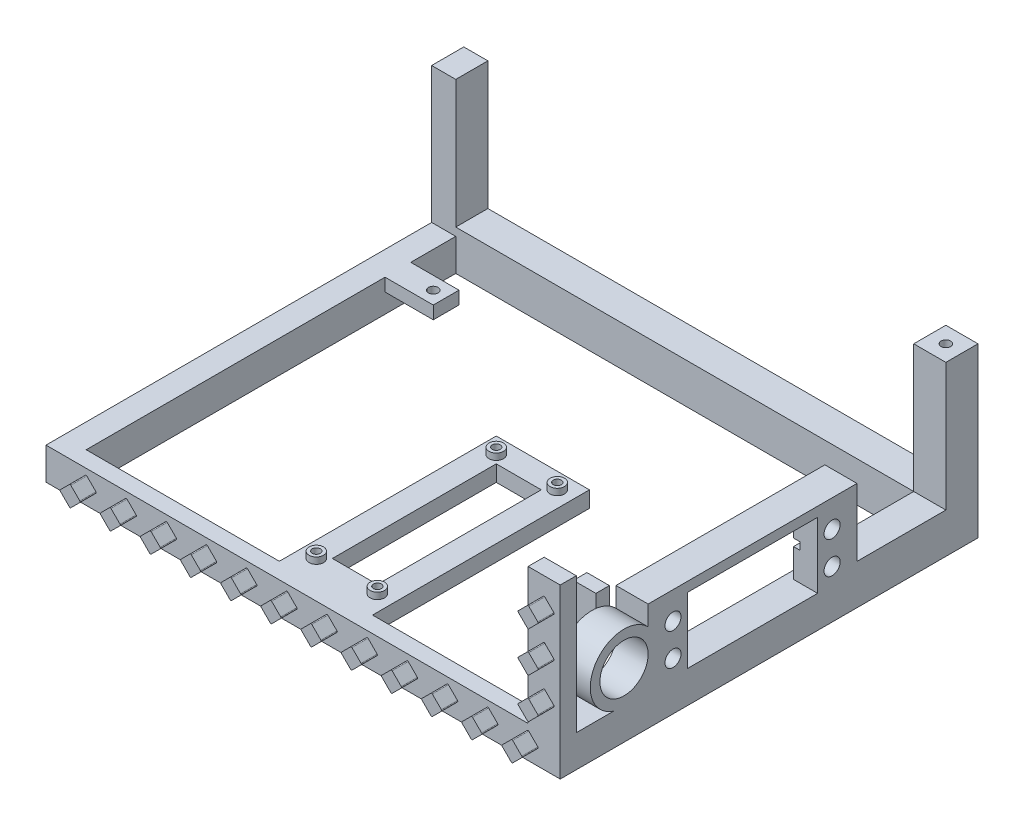
from build123d import *

# Parameters (mm, degrees)
SKETCH1_W            = 160
SKETCH1_H            = 130
BOSS_EXTRUDE1_DEPTH  = 10
BOSS_EXTRUDE2_DEPTH  = 42.3
BOSS_EXTRUDE3_DEPTH  = 5
SKETCH7_R            = 1.5
CUT_EXTRUDE2_DEPTH   = 118.958848757
CUT_EXTRUDE3_DEPTH   = 118.958848757
SKETCH11_R           = 1.5
CUT_EXTRUDE6_DEPTH   = 4
SKETCH12_W           = 142.5
SKETCH12_H           = 39.8
CUT_EXTRUDE7_DEPTH   = 160.954024645
SKETCH15_W           = 29
SKETCH15_H           = 67.5
SKETCH15_W_2         = 14
SKETCH15_H_2         = 51
SKETCH15_R           = 1.25
BOSS_EXTRUDE4_DEPTH  = 5
BOSS_EXTRUDE5_START  = 2
SKETCH15_4_R         = 2.25
SKETCH15_4_R_2       = 1.25
BOSS_EXTRUDE5_DEPTH  = 2
CUT_EXTRUDE20_DEPTH  = 5.25
SKETCH26_W           = 15
SKETCH26_H           = 8
CUT_EXTRUDE21_DEPTH  = 6
SKETCH36_W           = 55
SKETCH36_H           = 20.5
CUT_EXTRUDE27_DEPTH  = 2.5
SKETCH37_W           = 7.25
SKETCH37_H           = 2.3
CUT_EXTRUDE28_DEPTH  = 2
CUT_EXTRUDE30_DEPTH  = 10
SKETCH40_R           = 7.5
CUT_EXTRUDE32_DEPTH  = 10
SKETCH38_R           = 2.5
CUT_EXTRUDE33_DEPTH  = 10
SKETCH41_W           = 40.5
SKETCH41_H           = 20.5
CUT_EXTRUDE34_DEPTH  = 10
SKETCH48_W           = 4.2
SKETCH48_H           = 3
BOSS_EXTRUDE9_DEPTH  = 21.5
SKETCH49_W           = 7
SKETCH49_H           = 4.2
BOSS_EXTRUDE10_DEPTH = 10


with BuildPart() as part:
    # Sketch1 → Boss-Extrude1 (new body)
    with BuildSketch(Plane(origin=(0, 0, 0), x_dir=(1, 0, 0), z_dir=(0, 1, 0))):
        with Locations((-5, 5)):
            Rectangle(SKETCH1_W, SKETCH1_H)
    extrude(amount=BOSS_EXTRUDE1_DEPTH)

    # Sketch2 → Boss-Extrude2 (add)
    with BuildSketch(Plane(origin=(0, 10, 0), x_dir=(1, 0, 0), z_dir=(0, 1, 0))):
        Polygon((-85, 70), (75, 70), (75, -60), (65, -60), (65, 60), (-85, 60), align=None)
    extrude(amount=BOSS_EXTRUDE2_DEPTH)

    # Sketch6 → Boss-Extrude3 (add)
    with BuildSketch(Plane.XY.offset(60)):
        with BuildLine():
            Line((69.787867966, 40.612132034), (66.962132034, 43.437867966))
            ThreePointArc((66.962132034, 43.437867966), (66.874264069, 43.65), (66.962132034, 43.862132034))
            Line((66.962132034, 43.862132034), (69.787867966, 46.687867966))
            ThreePointArc((69.787867966, 46.687867966), (70, 46.775735931), (70.212132034, 46.687867966))
            Line((70.212132034, 46.687867966), (73.037867966, 43.862132034))
            ThreePointArc((73.037867966, 43.862132034), (73.125735931, 43.65), (73.037867966, 43.437867966))
            Line((73.037867966, 43.437867966), (70.212132034, 40.612132034))
            ThreePointArc((70.212132034, 40.612132034), (70, 40.524264069), (69.787867966, 40.612132034))
        make_face()
        with BuildLine():
            Line((-10.212132034, 8.037867966), (-13.037867966, 5.212132034))
            ThreePointArc((-13.037867966, 5.212132034), (-13.125735931, 5), (-13.037867966, 4.787867966))
            Line((-13.037867966, 4.787867966), (-10.212132034, 1.962132034))
            ThreePointArc((-10.212132034, 1.962132034), (-10, 1.874264069), (-9.787867966, 1.962132034))
            Line((-9.787867966, 1.962132034), (-6.962132034, 4.787867966))
            ThreePointArc((-6.962132034, 4.787867966), (-6.874264069, 5), (-6.962132034, 5.212132034))
            Line((-6.962132034, 5.212132034), (-9.787867966, 8.037867966))
            ThreePointArc((-9.787867966, 8.037867966), (-10, 8.125735931), (-10.212132034, 8.037867966))
        make_face()
        with BuildLine():
            Line((66.962132034, 31.362132034), (69.787867966, 34.187867966))
            ThreePointArc((69.787867966, 34.187867966), (70, 34.275735931), (70.212132034, 34.187867966))
            Line((70.212132034, 34.187867966), (73.037867966, 31.362132034))
            ThreePointArc((73.037867966, 31.362132034), (73.125735931, 31.15), (73.037867966, 30.937867966))
            Line((73.037867966, 30.937867966), (70.212132034, 28.112132034))
            ThreePointArc((70.212132034, 28.112132034), (70, 28.024264069), (69.787867966, 28.112132034))
            Line((69.787867966, 28.112132034), (66.962132034, 30.937867966))
            ThreePointArc((66.962132034, 30.937867966), (66.874264069, 31.15), (66.962132034, 31.362132034))
        make_face()
        with BuildLine():
            Line((5.537867966, 5.212132034), (2.712132034, 8.037867966))
            ThreePointArc((2.712132034, 8.037867966), (2.5, 8.125735931), (2.287867966, 8.037867966))
            Line((2.287867966, 8.037867966), (-0.537867966, 5.212132034))
            ThreePointArc((-0.537867966, 5.212132034), (-0.625735931, 5), (-0.537867966, 4.787867966))
            Line((-0.537867966, 4.787867966), (2.287867966, 1.962132034))
            ThreePointArc((2.287867966, 1.962132034), (2.5, 1.874264069), (2.712132034, 1.962132034))
            Line((2.712132034, 1.962132034), (5.537867966, 4.787867966))
            ThreePointArc((5.537867966, 4.787867966), (5.625735931, 5), (5.537867966, 5.212132034))
        make_face()
        with BuildLine():
            Line((18.037867966, 5.212132034), (15.212132034, 8.037867966))
            ThreePointArc((15.212132034, 8.037867966), (15, 8.125735931), (14.787867966, 8.037867966))
            Line((14.787867966, 8.037867966), (11.962132034, 5.212132034))
            ThreePointArc((11.962132034, 5.212132034), (11.874264069, 5), (11.962132034, 4.787867966))
            Line((11.962132034, 4.787867966), (14.787867966, 1.962132034))
            ThreePointArc((14.787867966, 1.962132034), (15, 1.874264069), (15.212132034, 1.962132034))
            Line((15.212132034, 1.962132034), (18.037867966, 4.787867966))
            ThreePointArc((18.037867966, 4.787867966), (18.125735931, 5), (18.037867966, 5.212132034))
        make_face()
        with BuildLine():
            Line((30.537867966, 5.212132034), (27.712132034, 8.037867966))
            ThreePointArc((27.712132034, 8.037867966), (27.5, 8.125735931), (27.287867966, 8.037867966))
            Line((27.287867966, 8.037867966), (24.462132034, 5.212132034))
            ThreePointArc((24.462132034, 5.212132034), (24.374264069, 5), (24.462132034, 4.787867966))
            Line((24.462132034, 4.787867966), (27.287867966, 1.962132034))
            ThreePointArc((27.287867966, 1.962132034), (27.5, 1.874264069), (27.712132034, 1.962132034))
            Line((27.712132034, 1.962132034), (30.537867966, 4.787867966))
            ThreePointArc((30.537867966, 4.787867966), (30.625735931, 5), (30.537867966, 5.212132034))
        make_face()
        with BuildLine():
            Line((43.037867966, 5.212132034), (40.212132034, 8.037867966))
            ThreePointArc((40.212132034, 8.037867966), (40, 8.125735931), (39.787867966, 8.037867966))
            Line((39.787867966, 8.037867966), (36.962132034, 5.212132034))
            ThreePointArc((36.962132034, 5.212132034), (36.874264069, 5), (36.962132034, 4.787867966))
            Line((36.962132034, 4.787867966), (39.787867966, 1.962132034))
            ThreePointArc((39.787867966, 1.962132034), (40, 1.874264069), (40.212132034, 1.962132034))
            Line((40.212132034, 1.962132034), (43.037867966, 4.787867966))
            ThreePointArc((43.037867966, 4.787867966), (43.125735931, 5), (43.037867966, 5.212132034))
        make_face()
        with BuildLine():
            Line((55.537867966, 5.212132034), (52.712132034, 8.037867966))
            ThreePointArc((52.712132034, 8.037867966), (52.5, 8.125735931), (52.287867966, 8.037867966))
            Line((52.287867966, 8.037867966), (49.462132034, 5.212132034))
            ThreePointArc((49.462132034, 5.212132034), (49.374264069, 5), (49.462132034, 4.787867966))
            Line((49.462132034, 4.787867966), (52.287867966, 1.962132034))
            ThreePointArc((52.287867966, 1.962132034), (52.5, 1.874264069), (52.712132034, 1.962132034))
            Line((52.712132034, 1.962132034), (55.537867966, 4.787867966))
            ThreePointArc((55.537867966, 4.787867966), (55.625735931, 5), (55.537867966, 5.212132034))
        make_face()
        with BuildLine():
            Line((68.037867966, 5.212132034), (65.212132034, 8.037867966))
            ThreePointArc((65.212132034, 8.037867966), (65, 8.125735931), (64.787867966, 8.037867966))
            Line((64.787867966, 8.037867966), (61.962132034, 5.212132034))
            ThreePointArc((61.962132034, 5.212132034), (61.874264069, 5), (61.962132034, 4.787867966))
            Line((61.962132034, 4.787867966), (64.787867966, 1.962132034))
            ThreePointArc((64.787867966, 1.962132034), (65, 1.874264069), (65.212132034, 1.962132034))
            Line((65.212132034, 1.962132034), (68.037867966, 4.787867966))
            ThreePointArc((68.037867966, 4.787867966), (68.125735931, 5), (68.037867966, 5.212132034))
        make_face()
        with BuildLine():
            Line((-19.462132034, 5.212132034), (-22.287867966, 8.037867966))
            ThreePointArc((-22.287867966, 8.037867966), (-22.5, 8.125735931), (-22.712132034, 8.037867966))
            Line((-22.712132034, 8.037867966), (-25.537867966, 5.212132034))
            ThreePointArc((-25.537867966, 5.212132034), (-25.625735931, 5), (-25.537867966, 4.787867966))
            Line((-25.537867966, 4.787867966), (-22.712132034, 1.962132034))
            ThreePointArc((-22.712132034, 1.962132034), (-22.5, 1.874264069), (-22.287867966, 1.962132034))
            Line((-22.287867966, 1.962132034), (-19.462132034, 4.787867966))
            ThreePointArc((-19.462132034, 4.787867966), (-19.374264069, 5), (-19.462132034, 5.212132034))
        make_face()
        with BuildLine():
            Line((-31.962132034, 5.212132034), (-34.787867966, 8.037867966))
            ThreePointArc((-34.787867966, 8.037867966), (-35, 8.125735931), (-35.212132034, 8.037867966))
            Line((-35.212132034, 8.037867966), (-38.037867966, 5.212132034))
            ThreePointArc((-38.037867966, 5.212132034), (-38.125735931, 5), (-38.037867966, 4.787867966))
            Line((-38.037867966, 4.787867966), (-35.212132034, 1.962132034))
            ThreePointArc((-35.212132034, 1.962132034), (-35, 1.874264069), (-34.787867966, 1.962132034))
            Line((-34.787867966, 1.962132034), (-31.962132034, 4.787867966))
            ThreePointArc((-31.962132034, 4.787867966), (-31.874264069, 5), (-31.962132034, 5.212132034))
        make_face()
        with BuildLine():
            Line((-44.462132034, 5.212132034), (-47.287867966, 8.037867966))
            ThreePointArc((-47.287867966, 8.037867966), (-47.5, 8.125735931), (-47.712132034, 8.037867966))
            Line((-47.712132034, 8.037867966), (-50.537867966, 5.212132034))
            ThreePointArc((-50.537867966, 5.212132034), (-50.625735931, 5), (-50.537867966, 4.787867966))
            Line((-50.537867966, 4.787867966), (-47.712132034, 1.962132034))
            ThreePointArc((-47.712132034, 1.962132034), (-47.5, 1.874264069), (-47.287867966, 1.962132034))
            Line((-47.287867966, 1.962132034), (-44.462132034, 4.787867966))
            ThreePointArc((-44.462132034, 4.787867966), (-44.374264069, 5), (-44.462132034, 5.212132034))
        make_face()
        with BuildLine():
            Line((-56.962132034, 5.212132034), (-59.787867966, 8.037867966))
            ThreePointArc((-59.787867966, 8.037867966), (-60, 8.125735931), (-60.212132034, 8.037867966))
            Line((-60.212132034, 8.037867966), (-63.037867966, 5.212132034))
            ThreePointArc((-63.037867966, 5.212132034), (-63.125735931, 5), (-63.037867966, 4.787867966))
            Line((-63.037867966, 4.787867966), (-60.212132034, 1.962132034))
            ThreePointArc((-60.212132034, 1.962132034), (-60, 1.874264069), (-59.787867966, 1.962132034))
            Line((-59.787867966, 1.962132034), (-56.962132034, 4.787867966))
            ThreePointArc((-56.962132034, 4.787867966), (-56.874264069, 5), (-56.962132034, 5.212132034))
        make_face()
        with BuildLine():
            Line((-69.462132034, 5.212132034), (-72.287867966, 8.037867966))
            ThreePointArc((-72.287867966, 8.037867966), (-72.5, 8.125735931), (-72.712132034, 8.037867966))
            Line((-72.712132034, 8.037867966), (-75.537867966, 5.212132034))
            ThreePointArc((-75.537867966, 5.212132034), (-75.625735931, 5), (-75.537867966, 4.787867966))
            Line((-75.537867966, 4.787867966), (-72.712132034, 1.962132034))
            ThreePointArc((-72.712132034, 1.962132034), (-72.5, 1.874264069), (-72.287867966, 1.962132034))
            Line((-72.287867966, 1.962132034), (-69.462132034, 4.787867966))
            ThreePointArc((-69.462132034, 4.787867966), (-69.374264069, 5), (-69.462132034, 5.212132034))
        make_face()
        with BuildLine():
            Line((69.787867966, 15.612132034), (66.962132034, 18.437867966))
            ThreePointArc((66.962132034, 18.437867966), (66.874264069, 18.65), (66.962132034, 18.862132034))
            Line((66.962132034, 18.862132034), (69.787867966, 21.687867966))
            ThreePointArc((69.787867966, 21.687867966), (70, 21.775735931), (70.212132034, 21.687867966))
            Line((70.212132034, 21.687867966), (73.037867966, 18.862132034))
            ThreePointArc((73.037867966, 18.862132034), (73.125735931, 18.65), (73.037867966, 18.437867966))
            Line((73.037867966, 18.437867966), (70.212132034, 15.612132034))
            ThreePointArc((70.212132034, 15.612132034), (70, 15.524264069), (69.787867966, 15.612132034))
        make_face()
    extrude(amount=BOSS_EXTRUDE3_DEPTH)

    # Sketch7 → Cut-Extrude2 (cut, through all)
    with BuildSketch(Plane(origin=(0, 10, 0), x_dir=(1, 0, 0), z_dir=(0, 1, 0))):
        with Locations((-66.5, 42)):
            Circle(SKETCH7_R)
    extrude(amount=-CUT_EXTRUDE2_DEPTH, mode=Mode.SUBTRACT)

    # Sketch8 → Cut-Extrude3 (cut, through all)
    with BuildSketch(Plane(origin=(0, 10, 0), x_dir=(1, 0, 0), z_dir=(0, 1, 0))):
        Polygon((-77.5, 60), (65, 60), (65, -55), (-77.5, -55), (-77.5, 38), (-62.5, 38), (-62.5, 46), (-77.5, 46), align=None)
    extrude(amount=-CUT_EXTRUDE3_DEPTH, mode=Mode.SUBTRACT)

    # Sketch11 → Cut-Extrude6 (cut)
    with BuildSketch(Plane(origin=(0, 52.3, 0), x_dir=(1, 0, 0), z_dir=(0, 1, 0))):
        with Locations((70, 65)):
            Circle(SKETCH11_R)
    extrude(amount=-CUT_EXTRUDE6_DEPTH, mode=Mode.SUBTRACT)

    # Sketch12 → Cut-Extrude7 (cut, through all)
    with BuildSketch(Plane.XY.offset(-60)):
        with Locations((-6.25, 32.4)):
            Rectangle(SKETCH12_W, SKETCH12_H)
    extrude(amount=-CUT_EXTRUDE7_DEPTH, mode=Mode.SUBTRACT)

    # Sketch15 → Boss-Extrude4 (add)
    with BuildSketch(Plane(origin=(0, 10, 0), x_dir=(1, 0, 0), z_dir=(0, 1, 0))):
        with Locations((-2.9, -21.25)):
            Rectangle(SKETCH15_W, SKETCH15_H)
        with Locations((-2.9, -20.5)):
            Rectangle(SKETCH15_W_2, SKETCH15_H_2, mode=Mode.SUBTRACT)
        with Locations((-12.4, -48.5)):
            Circle(SKETCH15_R, mode=Mode.SUBTRACT)
        with Locations((6.6, -48.5)):
            Circle(SKETCH15_R, mode=Mode.SUBTRACT)
        with Locations((-12.4, 7.5)):
            Circle(SKETCH15_R, mode=Mode.SUBTRACT)
        with Locations((6.6, 7.5)):
            Circle(SKETCH15_R, mode=Mode.SUBTRACT)
    extrude(amount=-BOSS_EXTRUDE4_DEPTH)

    # Sketch15<4> → Boss-Extrude5 (add)
    # profile 1 of 4: a face of its own
    with BuildSketch(Plane(origin=(0, 10, 0), x_dir=(1, 0, 0), z_dir=(0, 1, 0)).offset(BOSS_EXTRUDE5_START)):
        with Locations((-12.4, 7.5)):
            Circle(SKETCH15_4_R)
        with Locations((-12.4, 7.5)):
            Circle(SKETCH15_4_R_2, mode=Mode.SUBTRACT)
    # profile 2 of 4: a face of its own
    with BuildSketch(Plane(origin=(0, 10, 0), x_dir=(1, 0, 0), z_dir=(0, 1, 0)).offset(BOSS_EXTRUDE5_START)):
        with Locations((6.6, 7.5)):
            Circle(SKETCH15_4_R)
        with Locations((6.6, 7.5)):
            Circle(SKETCH15_4_R_2, mode=Mode.SUBTRACT)
    # profile 3 of 4: a face of its own
    with BuildSketch(Plane(origin=(0, 10, 0), x_dir=(1, 0, 0), z_dir=(0, 1, 0)).offset(BOSS_EXTRUDE5_START)):
        with Locations((-12.4, -48.5)):
            Circle(SKETCH15_4_R)
        with Locations((-12.4, -48.5)):
            Circle(SKETCH15_4_R_2, mode=Mode.SUBTRACT)
    # profile 4 of 4: a face of its own
    with BuildSketch(Plane(origin=(0, 10, 0), x_dir=(1, 0, 0), z_dir=(0, 1, 0)).offset(BOSS_EXTRUDE5_START)):
        with Locations((6.6, -48.5)):
            Circle(SKETCH15_4_R)
        with Locations((6.6, -48.5)):
            Circle(SKETCH15_4_R_2, mode=Mode.SUBTRACT)
    extrude(amount=-BOSS_EXTRUDE5_DEPTH)

    # Sketch25 → Cut-Extrude20 (cut)
    with BuildSketch(Plane.ZY.offset(85)):
        Polygon((0, 8.425), (-3.425, 5), (0, 1.575), (3.425, 5), align=None)
        Polygon((15.925, 5), (12.5, 8.425), (9.075, 5), (12.5, 1.575), align=None)
        Polygon((28.425, 5), (25, 8.425), (21.575, 5), (25, 1.575), align=None)
        Polygon((40.925, 5), (37.5, 8.425), (34.075, 5), (37.5, 1.575), align=None)
        Polygon((53.425, 5), (50, 8.425), (46.575, 5), (50, 1.575), align=None)
        Polygon((-9.075, 5), (-12.5, 8.425), (-15.925, 5), (-12.5, 1.575), align=None)
        Polygon((-21.575, 5), (-25, 8.425), (-28.425, 5), (-25, 1.575), align=None)
        Polygon((-34.075, 5), (-37.5, 8.425), (-40.925, 5), (-37.5, 1.575), align=None)
        Polygon((-46.575, 5), (-50, 8.425), (-53.425, 5), (-50, 1.575), align=None)
        Polygon((-59.075, 5), (-62.5, 8.425), (-65.925, 5), (-62.5, 1.575), align=None)
        Polygon((-68.425, 31.15), (-65, 34.575), (-61.575, 31.15), (-65, 27.725), align=None)
        Polygon((-65, 15.225), (-68.425, 18.65), (-65, 22.075), (-61.575, 18.65), align=None)
        Polygon((-65, 40.225), (-68.425, 43.65), (-65, 47.075), (-61.575, 43.65), align=None)
    extrude(amount=-CUT_EXTRUDE20_DEPTH, mode=Mode.SUBTRACT)

    # Sketch26 → Cut-Extrude21 (cut)
    with BuildSketch(Plane.XZ):
        with Locations((-70, -42)):
            Rectangle(SKETCH26_W, SKETCH26_H)
    extrude(amount=-CUT_EXTRUDE21_DEPTH, mode=Mode.SUBTRACT)

    # Sketch36 → Cut-Extrude27 (cut)
    with BuildSketch(Plane.ZY.offset(-65)):
        with Locations((0.15, 20.25)):
            Rectangle(SKETCH36_W, SKETCH36_H)
    extrude(amount=-CUT_EXTRUDE27_DEPTH, mode=Mode.SUBTRACT)

    # Sketch37 → Cut-Extrude28 (cut)
    with BuildSketch(Plane.ZY.offset(-67.5)):
        with Locations((-23.725, 20)):
            Rectangle(SKETCH37_W, SKETCH37_H)
    cut_extrude28 = extrude(amount=-CUT_EXTRUDE28_DEPTH, mode=Mode.SUBTRACT)

    # Sketch39 → Cut-Extrude30 (cut)
    with BuildSketch(Plane.ZY.offset(-65)):
        Polygon((-60, 52.3), (-60, 12.5), (-32.35, 12.5), (-32.35, 33.5), (55, 33.5), (55, 52.3), align=None)
    extrude(amount=-CUT_EXTRUDE30_DEPTH, mode=Mode.SUBTRACT)

    # Sketch40 → Cut-Extrude32 (cut)
    with BuildSketch(Plane.ZY.offset(-65)):
        with BuildLine():
            Line((55, 10), (55, 33.5))
            Line((55, 33.5), (32.65, 33.5))
            Line((32.65, 33.5), (32.65, 27.348469228))
            ThreePointArc((32.65, 27.348469228), (49.08652551, 25.512577601), (43.351562119, 10))
            Line((43.351562119, 10), (55, 10))
        make_face()
        with Locations((40.15, 20)):
            Circle(SKETCH40_R)
    extrude(amount=-CUT_EXTRUDE32_DEPTH, mode=Mode.SUBTRACT)

    # Sketch38 → Cut-Extrude33 (cut)
    with BuildSketch(Plane.ZY.offset(-67.5)):
        with Locations((-24.6, 25)):
            Circle(SKETCH38_R)
        with Locations((-24.6, 15)):
            Circle(SKETCH38_R)
    cut_extrude33 = extrude(amount=-CUT_EXTRUDE33_DEPTH, mode=Mode.SUBTRACT)

    # Sketch41 → Cut-Extrude34 (cut)
    with BuildSketch(Plane.ZY.offset(-67.5)):
        with Locations((0.15, 20.25)):
            Rectangle(SKETCH41_W, SKETCH41_H)
    extrude(amount=-CUT_EXTRUDE34_DEPTH, mode=Mode.SUBTRACT)

    # Mirror1: Cut-Extrude28, Cut-Extrude33 across plane
    add(cut_extrude28.mirror(Plane.XY.offset(0.15)), mode=Mode.SUBTRACT)
    add(cut_extrude33.mirror(Plane.XY.offset(0.15)), mode=Mode.SUBTRACT)

    # Sketch48 → Boss-Extrude9 (add)
    with BuildSketch(Plane.ZY.offset(-65)):
        with Locations((22.3, 8.5)):
            Rectangle(SKETCH48_W, SKETCH48_H)
    extrude(amount=BOSS_EXTRUDE9_DEPTH)

    # Sketch49 → Boss-Extrude10 (add)
    with BuildSketch(Plane(origin=(0, 10, 0), x_dir=(1, 0, 0), z_dir=(0, 1, 0))):
        with Locations((47, -22.3)):
            Rectangle(SKETCH49_W, SKETCH49_H)
    extrude(amount=BOSS_EXTRUDE10_DEPTH)


solid = part.part
